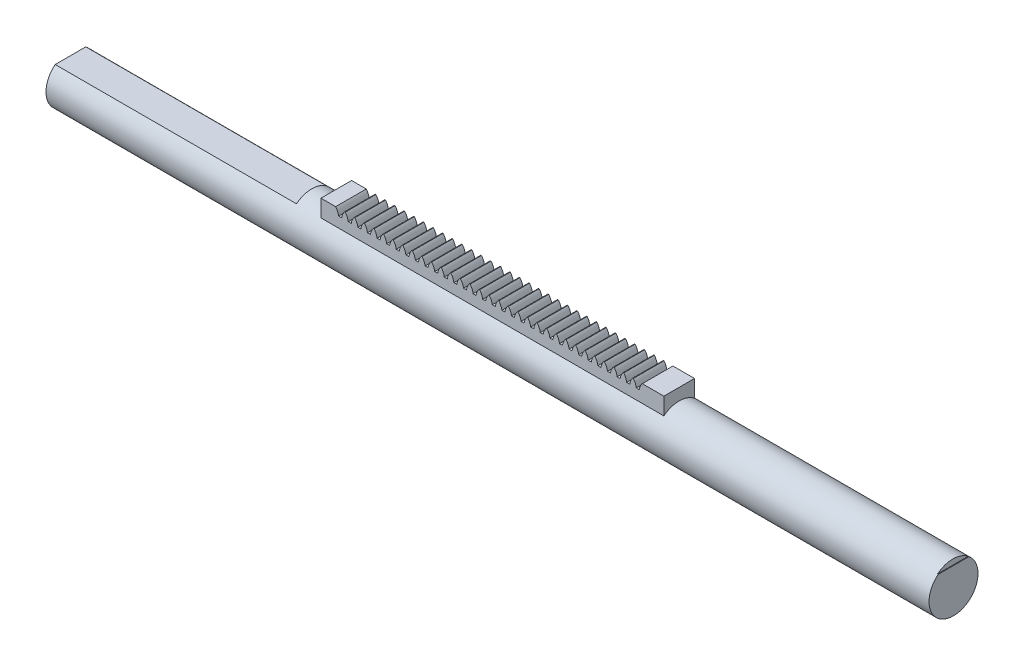
from build123d import *
from build123d.topology import SkipClean

# Parameters (mm, degrees)
SKETCH1_W                = 150
SKETCH1_H                = 7
BOSS_EXTRUDE2_DEPTH      = 6.25
CUT_EXTRUDE1_DEPTH       = 140.036501376
LPATTERN1_COUNT          = 32
LPATTERN1_PITCH          = 3.92
CUT_EXTRUDE2_START       = -6.25
CUT_EXTRUDE2_OUTLINE_W   = 4.009572156
CUT_EXTRUDE2_OUTLINE_H   = 7
CUT_EXTRUDE2_OUTLINE_W_2 = 6
CUT_EXTRUDE2_DEPTH       = 12.5
BOSS_EXTRUDE3_DEPTH      = 112
BOSS_EXTRUDE3_DEPTH_BACK = 248.5
SKETCH7_R                = 10
BOSS_EXTRUDE4_DEPTH      = 111.735590033
SKETCH8_R                = 6
CUT_EXTRUDE3_DEPTH       = 22
BOSS_EXTRUDE5_START      = 10
SKETCH10_R               = 10
BOSS_EXTRUDE5_DEPTH      = 10
CUT_EXTRUDE5_START       = -22
SKETCH11_R               = 6
CUT_EXTRUDE5_DEPTH       = 22


# Read off the part's stored shape, not the designer's step: Cut-Extrude2
with BuildPart() as part:
    # Sketch1 → Boss-Extrude2 (new, symmetric)
    with BuildSketch(Plane.XY):
        with Locations((63.159569831, 10.783538746)):
            Rectangle(SKETCH1_W, SKETCH1_H)
    extrude(amount=BOSS_EXTRUDE2_DEPTH, both=True)

    # Sketch2 → Cut-Extrude1 (cut, symmetric)
    with BuildSketch(Plane.XY):
        with BuildLine():
            ThreePointArc((0.615260942, 11.545117419), (0, 11.5615), (-0.615260942, 11.545117419))
            ThreePointArc((-0.615260942, 11.545117419), (-1.023565158, 13.002884474), (-1.830858013, 14.283538746))
            ThreePointArc((-1.830858013, 14.283538746), (0, 14.4004), (1.830858013, 14.283538746))
            ThreePointArc((1.830858013, 14.283538746), (1.023565158, 13.002884474), (0.615260942, 11.545117419))
        make_face()
    cut_extrude1 = extrude(amount=CUT_EXTRUDE1_DEPTH, both=True, mode=Mode.SUBTRACT)

    # LPattern1: Cut-Extrude1 ×32
    with Locations(*[(i * LPATTERN1_PITCH, 0, 0) for i in range(1, LPATTERN1_COUNT)]):
        add(cut_extrude1, mode=Mode.SUBTRACT)

    # Cut-Extrude2 outline → Cut-Extrude2 (cut)
    with BuildSketch(Plane.XY.offset(CUT_EXTRUDE2_START)):
        with Locations((-9.835644091, 10.783538746)):
            Rectangle(CUT_EXTRUDE2_OUTLINE_W, CUT_EXTRUDE2_OUTLINE_H)
        with Locations((135.159569831, 10.783538746)):
            Rectangle(CUT_EXTRUDE2_OUTLINE_W_2, CUT_EXTRUDE2_OUTLINE_H)
    extrude(amount=CUT_EXTRUDE2_DEPTH, mode=Mode.SUBTRACT)

    # Sketch5 → Boss-Extrude3 (add, two sides: drawn at the far end of the back side and taken through both)
    with BuildSketch(Plane(origin=(132.159569831, 0, 0), x_dir=(0, 0, -1), z_dir=(1, 0, 0)).offset(-BOSS_EXTRUDE3_DEPTH_BACK)):
        with BuildLine():
            Line((6.25, 7.283538746), (-6.25, 7.283538746))
            ThreePointArc((-6.25, 7.283538746), (0, -10.522708752), (6.25, 7.283538746))
        make_face()
    extrude(amount=BOSS_EXTRUDE3_DEPTH + BOSS_EXTRUDE3_DEPTH_BACK)

    # Sketch7 → Boss-Extrude4 (add)
    with BuildSketch(Plane(origin=(132.159569831, 0, 0), x_dir=(0, 0, -1), z_dir=(1, 0, 0))):
        with Locations(Location((0, -0.522708752, 0), (0, 0, 128.682187453))):
            Circle(SKETCH7_R)
    extrude(amount=BOSS_EXTRUDE4_DEPTH)

    # Sketch8 → Cut-Extrude3 (cut)
    with BuildSketch(Plane(origin=(243.895159863, 0, 0), x_dir=(0, 0, -1), z_dir=(1, 0, 0))):
        with Locations(Location((0, -0.522708752, 0), (0, 0, 90))):
            Circle(SKETCH8_R)
    extrude(amount=-CUT_EXTRUDE3_DEPTH, mode=Mode.SUBTRACT)

    # Sketch10 → Boss-Extrude5 (add)
    with SkipClean():  # the faces are left unmerged after this step: merging them gives an invalid solid
        with BuildSketch(Plane.ZY.offset(7.830858013).offset(BOSS_EXTRUDE5_START)):
            with Locations(Location((0, -0.522708752, 0), (0, 0, 128.682187453))):
                Circle(SKETCH10_R)
        extrude(amount=-BOSS_EXTRUDE5_DEPTH)
    add(part.part.scale(1), mode=Mode.REPLACE)  # the faces are merged on a copy

    # Sketch11 → Cut-Extrude5 (cut)
    with BuildSketch(Plane.ZY.offset(17.830858013).offset(CUT_EXTRUDE5_START)):
        with Locations(Location((0, -0.522708752, 0), (0, 0, 90))):
            Circle(SKETCH11_R)
    extrude(amount=CUT_EXTRUDE5_DEPTH, mode=Mode.SUBTRACT)


solid = part.part
